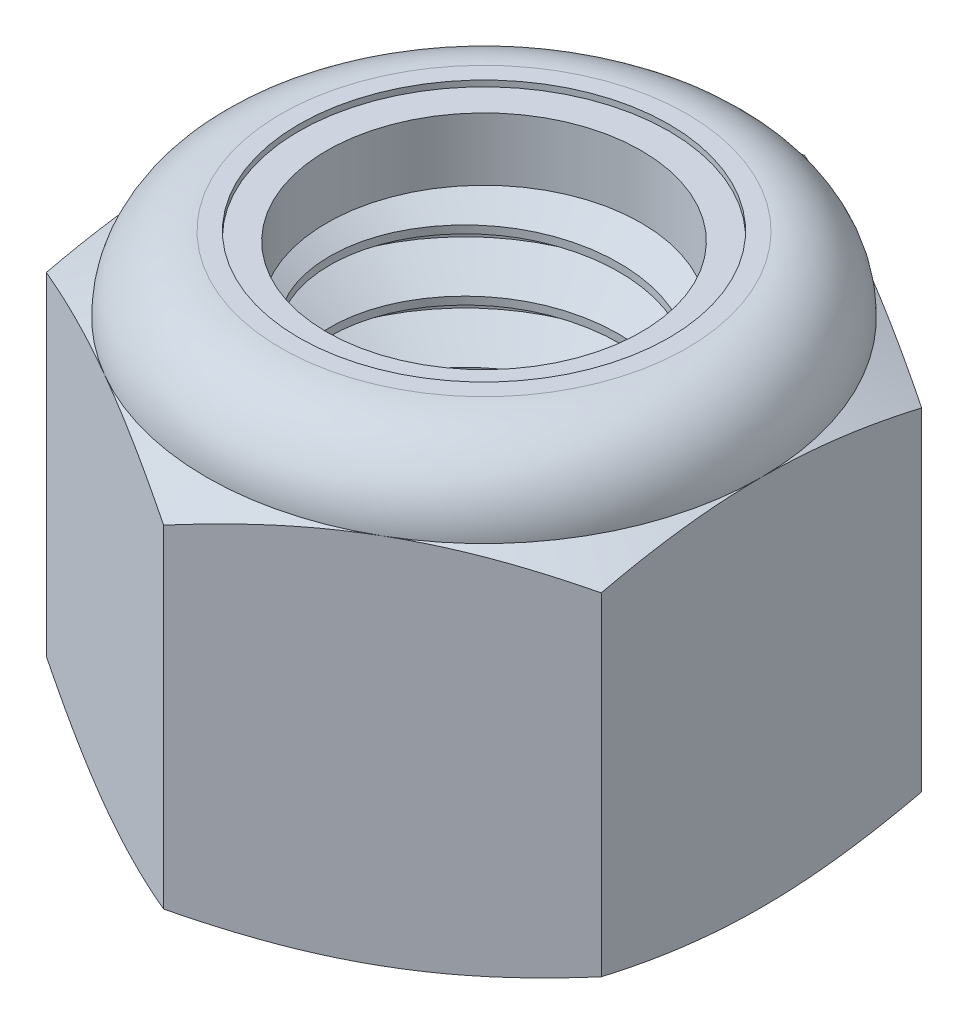
from build123d import *

# Parameters (mm, degrees)
SKETCH1_R        = 4.7625
EXTRUDE1_DEPTH   = 11.509375
SKETCH2_W        = 4.7625
SKETCH2_H        = 9.591145833
CUT_SWEEP1_PITCH = 1.5875
SKETCH12_W       = 5.23875
SKETCH12_H       = 9.591145833


with BuildPart() as part:
    # Sketch1 → Extrude1 (new body)
    with BuildSketch(Plane(origin=(0, 0, 0), x_dir=(1, 0, 0), z_dir=(0, 1, 0))):
        Polygon((0, 8.248891971), (-7.14375, 4.124445986), (-7.14375, -4.124445986), (0, -8.248891971), (7.14375, -4.124445986), (7.14375, 4.124445986), align=None)
        with Locations(Location((0, 0, 0), (0, 0, 270))):
            Circle(SKETCH1_R, mode=Mode.SUBTRACT)
    extrude(amount=EXTRUDE1_DEPTH)

    # Sketch5 → Cut-Revolve3 (revolve, cut)
    with BuildSketch(Plane(origin=(0, 0, 0), x_dir=(0, 0, -1), z_dir=(1, 0, 0))):
        with BuildLine():
            Line((0, 0), (7.14375, 0))
            Line((7.14375, 0), (8.248891971, 0.515336164))
            Line((8.248891971, 0.515336164), (8.248891971, 9.075809669))
            Line((8.248891971, 9.075809669), (7.14375, 9.591145833))
            ThreePointArc((7.14375, 9.591145833), (6.581913685, 10.947538685), (5.225520833, 11.509375))
            Line((5.225520833, 11.509375), (5.225520833, 12.779375))
            Line((5.225520833, 12.779375), (9.518891971, 12.779375))
            Line((9.518891971, 12.779375), (9.518891971, -1.27))
            Line((9.518891971, -1.27), (0, -1.27))
            Line((0, -1.27), (0, 0))
        make_face()
    revolve(axis=Axis((0, 0, 0), (0, 1, 0)), mode=Mode.SUBTRACT)

    # Sketch6 → Cut-Revolve4 (revolve, cut)
    with BuildSketch(Plane(origin=(0, 0, 0), x_dir=(0, 0, -1), z_dir=(1, 0, 0)), mode=Mode.PRIVATE) as cut_revolve4_sk:
        with BuildLine():
            Line((0, 9.591145833), (6.99135, 9.591145833))
            ThreePointArc((6.99135, 9.591145833), (6.474150612, 10.839775612), (5.225520833, 11.356975))
            Line((5.225520833, 11.356975), (2.612760417, 11.356975))
            Line((2.612760417, 11.356975), (2.612760417, 12.779375))
            Line((2.612760417, 12.779375), (0, 12.779375))
            Line((0, 12.779375), (0, 9.591145833))
        make_face()
    revolve(cut_revolve4_sk.sketch.rotate(Axis((0, 12.779375, 0), (0, -1, 0)), 180), axis=Axis((0, 12.779375, 0), (0, -1, 0)), mode=Mode.SUBTRACT)

    # Sketch4 → Cut-Revolve2 (revolve, cut)
    with BuildSketch(Plane(origin=(0, 0, 0), x_dir=(0, 0, -1), z_dir=(1, 0, 0))):
        Polygon((0, 9.591145833), (5.23875, 9.591145833), (0, 7.148276589), align=None)
        Polygon((0, 2.442869244), (5.23875, 0), (0, 0), align=None)
    revolve(axis=Axis((0, 0, 0), (0, 1, 0)), mode=Mode.SUBTRACT)

    # Sketch12 → Revolve4 (revolve)
    with BuildSketch(Plane(origin=(0, 0, 0), x_dir=(0, 0, -1), z_dir=(1, 0, 0)), mode=Mode.PRIVATE) as revolve4_sk:
        with Locations((2.619375, 4.795572917)):
            Rectangle(SKETCH12_W, SKETCH12_H)
    revolve(revolve4_sk.sketch.rotate(Axis((0, 0, 0), (0, 1, 0)), 9.622539968), axis=Axis((0, 0, 0), (0, 1, 0)))


with BuildPart() as body_2:
    # Sketch7 → Revolve2 (revolve)
    with BuildSketch(Plane(origin=(0, 0, 0), x_dir=(0, 0, -1), z_dir=(1, 0, 0))):
        with BuildLine():
            Line((4.048125, 9.667345833), (6.913430867, 9.667345833))
            ThreePointArc((6.913430867, 9.667345833), (6.39301751, 10.812537757), (5.225520833, 11.280775))
            Line((5.225520833, 11.280775), (4.048125, 11.280775))
            Line((4.048125, 11.280775), (4.048125, 9.667345833))
        make_face()
    revolve(axis=Axis((0, 9.667345833, 0), (0, 1, 0)))


with BuildPart() as body_3:
    # Sketch2 → Revolve1 (revolve)
    with BuildSketch(Plane(origin=(0, 0, 0), x_dir=(0, 0, -1), z_dir=(1, 0, 0))):
        with Locations((2.38125, 4.795572917)):
            Rectangle(SKETCH2_W, SKETCH2_H)
    revolve(axis=Axis((0, -4.7625, 0), (0, 1, 0)))

    # Cut-Sweep1: the profile of Sketch9 screwed along a right-hand helix of 8.25 turns, 8 arcs to a turn; built about Z, then put on its axis
    cut_sweep1_z = Axis((0, 0, 0), (0, 0, 1))
    cut_sweep1_corners = [(4.934351916, 0, 0.09921875), (4.848425958, 0, -1.438671875), (3.731388504, 0, -0.79375), (3.731388504, 0, -0.5953125)]
    with BuildLine(mode=Mode.PRIVATE) as cut_sweep1_profile:
        Line(cut_sweep1_corners[0], cut_sweep1_corners[1])
        Line(cut_sweep1_corners[1], cut_sweep1_corners[2])
        Line(cut_sweep1_corners[2], cut_sweep1_corners[3])
        Line(cut_sweep1_corners[3], cut_sweep1_corners[0])
    cut_sweep1_cap = Face(cut_sweep1_profile.wire())
    cut_sweep1_turn_angles = [0, 22.5, 45, 67.5, 90, 112.5, 135, 157.5, 180, 202.5, 225, 247.5, 270, 292.5, 315, 337.5, 360]
    cut_sweep1_turn_weights = [1, 0.9238795325112867, 1, 0.9238795325112867, 1, 0.9238795325112867, 1, 0.9238795325112867, 1, 0.9238795325112867, 1, 0.9238795325112867, 1, 0.9238795325112867, 1, 0.9238795325112867, 1]
    cut_sweep1_turn_rails = [Edge.make_bspline([Vector(p[0], p[1], 0).rotate(cut_sweep1_z, cut_sweep1_turn_angles[k]) / cut_sweep1_turn_weights[k] + Vector(0, 0, p[2] + CUT_SWEEP1_PITCH * cut_sweep1_turn_angles[k] / 360) for k in range(17)], [0, 0, 0, 1, 1, 2, 2, 3, 3, 4, 4, 5, 5, 6, 6, 7, 7, 8, 8, 8], 2, cut_sweep1_turn_weights) for p in cut_sweep1_corners]
    cut_sweep1_turn_sides = [Face.make_surface_from_curves(cut_sweep1_turn_rails[p[0]], cut_sweep1_turn_rails[p[1]]) for p in [(0, 1), (1, 2), (2, 3), (3, 0)]]
    cut_sweep1_last_angles = [2880, 2902.5, 2925, 2947.5, 2970]
    cut_sweep1_last_weights = [1, 0.9238795325112867, 1, 0.9238795325112185, 1]
    cut_sweep1_last_rails = [Edge.make_bspline([Vector(p[0], p[1], 0).rotate(cut_sweep1_z, cut_sweep1_last_angles[k]) / cut_sweep1_last_weights[k] + Vector(0, 0, p[2] + CUT_SWEEP1_PITCH * cut_sweep1_last_angles[k] / 360) for k in range(5)], [0, 0, 0, 1, 1, 2, 2, 2], 2, cut_sweep1_last_weights) for p in cut_sweep1_corners]
    cut_sweep1_last_sides = [Face.make_surface_from_curves(cut_sweep1_last_rails[p[0]], cut_sweep1_last_rails[p[1]]) for p in [(0, 1), (1, 2), (2, 3), (3, 0)]]
    cut_sweep1 = Plane(origin=(0, 9.591145833, 0), x_dir=(0, 0, -1), z_dir=(0, -1, 0)) * Solid(Shell([*[p.moved(Location((0, 0, CUT_SWEEP1_PITCH * i))) for i in range(8) for p in cut_sweep1_turn_sides], *cut_sweep1_last_sides, cut_sweep1_cap, cut_sweep1_cap.rotate(cut_sweep1_z, 2970).moved(Location((0, 0, CUT_SWEEP1_PITCH * 2970 / 360)))]))
    add(cut_sweep1, mode=Mode.SUBTRACT)

    # Sketch11 → Revolve3 (revolve)
    with BuildSketch(Plane(origin=(0, 0, 0), x_dir=(0, 0, -1), z_dir=(1, 0, 0))):
        Polygon((0, 0), (5.23875, 0), (0, 2.442869244), align=None)
    revolve(axis=Axis((0, 11.509375, 0), (0, -1, 0)))


with BuildPart() as part_1:
    add(part.part)

    # Combine1: cut body 3
    add(body_3.part, mode=Mode.SUBTRACT)


solid = Compound([body_2.part, part_1.part])
